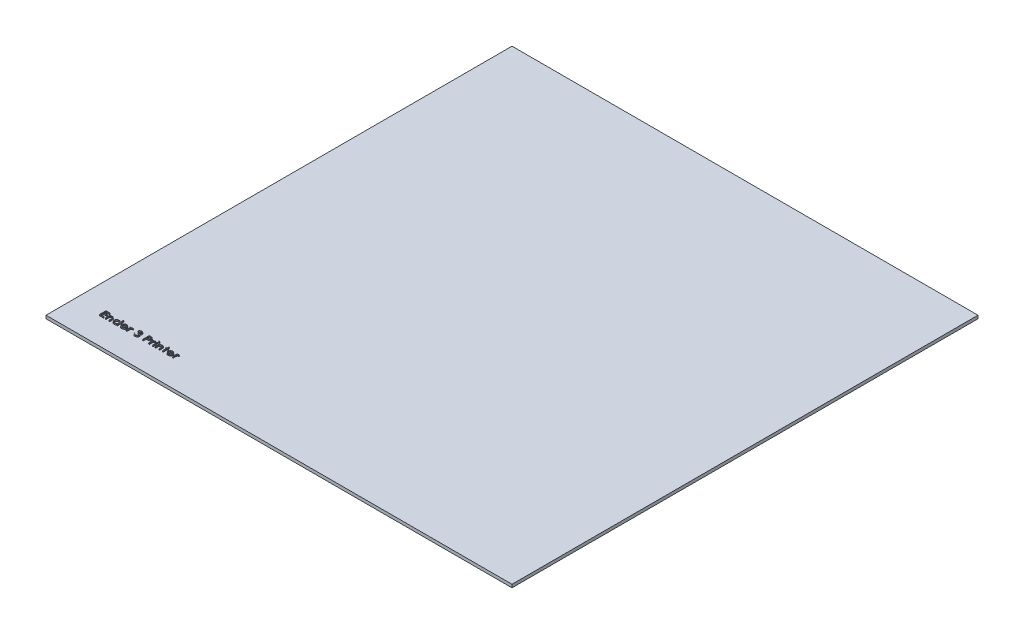
from build123d import *

# Parameters (mm, degrees)
CLAMP_DEPTH            = 10
CLAMP_DEPTH_BACK       = 10
SKETCH2_R              = 1
WHEEL_NUB_DEPTH        = 5.08
SKETCH3_W              = 225
SKETCH3_H              = 225
BED_DEPTH              = 1.5
INNER_FILLET_R         = 2.54
BOTTOM_CHAMFER_SIZE    = 0.254
PEG_CHAMFER_SIZE       = 0.254
BOSS_EXTRUDE4_DEPTH    = 0.5
BOSS_EXTRUDE4_2_DEPTH  = 0.5
BOSS_EXTRUDE4_3_DEPTH  = 0.5
BOSS_EXTRUDE4_4_DEPTH  = 0.5
BOSS_EXTRUDE4_5_DEPTH  = 0.5
BOSS_EXTRUDE4_6_DEPTH  = 0.5
BOSS_EXTRUDE4_7_DEPTH  = 0.5
BOSS_EXTRUDE4_8_DEPTH  = 0.5
BOSS_EXTRUDE4_9_DEPTH  = 0.5
SKETCH6_W              = 0.325641026
SKETCH6_H              = 2.320192308
BOSS_EXTRUDE4_10_DEPTH = 0.5
BOSS_EXTRUDE4_11_DEPTH = 0.5
BOSS_EXTRUDE4_12_DEPTH = 0.5
BOSS_EXTRUDE4_13_DEPTH = 0.5
BOSS_EXTRUDE4_14_DEPTH = 0.5


with BuildPart() as part:
    # Sketch1 → Clamp (new, two sides: drawn at the far end of the back side and taken through both)
    with BuildSketch(Plane.XY.offset(-CLAMP_DEPTH_BACK)):
        Polygon((-9.75, -8.5), (-9.75, 8.5), (9.75, 8.5), (9.75, -8.5), (11.25, -8.5), (11.25, 8.5), (11.25, 10), (-11.25, 10), (-11.25, 8.5), (-11.25, -8.5), align=None)
    extrude(amount=CLAMP_DEPTH + CLAMP_DEPTH_BACK)

    # Sketch2 → Wheel Nub (add)
    with BuildSketch(Plane(origin=(-9.75, 0, 0), x_dir=(0, 0, -1), z_dir=(1, 0, 0))):
        with Locations((-6, -5.5)):
            Circle(SKETCH2_R)
        with Locations((6, -5.5)):
            Circle(SKETCH2_R)
    wheel_nub = extrude(amount=WHEEL_NUB_DEPTH)

    # Nub Mirror: Wheel Nub across plane
    add(wheel_nub.mirror(Plane(origin=(0, 0, 0), x_dir=(0, 0, 1), z_dir=(1, 0, 0))))

    # Inner Fillet
    inner_fillet_edges = [part.edges().sort_by_distance(p)[0] for p in [
        (9.75, 8.5, 0),
        (-9.75, 8.5, 0),
    ]]
    fillet(inner_fillet_edges, radius=INNER_FILLET_R)

    # Bottom Chamfer
    bottom_chamfer_edges = [part.edges().sort_by_distance(p)[0] for p in [
        (10.5, -8.5, -10),
        (9.75, -8.5, 0),
        (10.5, -8.5, 10),
        (11.25, -8.5, 0),
        (-10.5, -8.5, -10),
        (-11.25, -8.5, 0),
        (-10.5, -8.5, 10),
        (-9.75, -8.5, 0),
    ]]
    chamfer(bottom_chamfer_edges, length=BOTTOM_CHAMFER_SIZE)

    # Peg Chamfer
    peg_chamfer_edges = [part.edges().sort_by_distance(p)[0] for p in [
        (-9.75, -5.5, -5),
        (-9.75, -5.5, 7),
        (9.75, -5.5, -5),
        (9.75, -5.5, 7),
    ]]
    chamfer(peg_chamfer_edges, length=PEG_CHAMFER_SIZE)


with BuildPart() as body_2:
    # Sketch3 → Bed (new body)
    with BuildSketch(Plane(origin=(0, 10, 0), x_dir=(1, 0, 0), z_dir=(0, 1, 0))):
        Rectangle(SKETCH3_W, SKETCH3_H)
    extrude(amount=BED_DEPTH)


with BuildPart() as body_3:
    # Sketch6 → Boss-Extrude4 (new body)
    with BuildSketch(Plane(origin=(0, 11.5, 0), x_dir=(1, 0, 0), z_dir=(0, 1, 0))):
        Polygon((-99.392948718, -96.625), (-97.439102564, -96.625), (-97.439102564, -96.950641026), (-99.067307692, -96.950641026), (-99.067307692, -97.927564103), (-97.439102564, -97.927564103), (-97.439102564, -98.253205128), (-99.067307692, -98.253205128), (-99.067307692, -99.474358974), (-97.439102564, -99.474358974), (-97.439102564, -99.8), (-99.392948718, -99.8), align=None)
    extrude(amount=BOSS_EXTRUDE4_DEPTH)


with BuildPart() as body_4:
    # Sketch6 → Boss-Extrude4 2 (new body)
    with BuildSketch(Plane(origin=(0, 11.5, 0), x_dir=(1, 0, 0), z_dir=(0, 1, 0))):
        with BuildLine():
            Line((-96.580224359, -97.479807692), (-96.254583333, -97.479807692))
            Line((-96.254583333, -97.479807692), (-96.254583333, -97.898307292))
            add(Edge.make_bspline(
                [(-96.254583333, -97.898307292), (-96.222662208, -97.860335804), (-96.160612491, -97.786525119), (-96.057773282, -97.689468383), (-95.948848934, -97.610218487), (-95.835222785, -97.546073852), (-95.715953468, -97.498720726), (-95.592207951, -97.46382747), (-95.463219432, -97.44321299), (-95.3754675, -97.440483195), (-95.331085737, -97.439102564)],
                knots=[0, 0, 0, 0, 1.111920242, 2.161400535, 3.161851767, 4.126104967, 5.07964332, 6.032517633, 7.00491838, 8, 8, 8, 8], degree=3))
            add(Edge.make_bspline(
                [(-95.331085737, -97.439102564), (-95.286246428, -97.440687296), (-95.198435288, -97.443790757), (-95.070436397, -97.46829981), (-94.950619804, -97.509969111), (-94.839720928, -97.567269255), (-94.739858611, -97.638544491), (-94.652244001, -97.721572994), (-94.579587428, -97.817093742), (-94.531150512, -97.906007654), (-94.498509392, -97.984526859), (-94.479129186, -98.052170752), (-94.460683214, -98.126898678), (-94.447583938, -98.209735617), (-94.435630076, -98.300015352), (-94.428765312, -98.398352332), (-94.423133419, -98.504154837), (-94.422948119, -98.577352966), (-94.422852564, -98.615099159)],
                knots=[0, 0, 0, 0, 1.266569471, 2.480388575, 3.666522241, 4.840213016, 5.995671761, 7.122871635, 8.238500001, 9.37270005, 9.9746134, 10.638003633, 11.358784284, 12.148732632, 13.006310612, 13.931773607, 14.933474477, 16, 16, 16, 16], degree=3))
            Line((-94.422852564, -98.615099159), (-94.422852564, -99.8))
            Line((-94.422852564, -99.8), (-94.74849359, -99.8))
            Line((-94.74849359, -99.8), (-94.74849359, -98.70859375))
            add(Edge.make_bspline(
                [(-94.74849359, -98.70859375), (-94.74836273, -98.677003925), (-94.748112416, -98.616577316), (-94.749810492, -98.530084677), (-94.750837813, -98.451635429), (-94.752610331, -98.381448374), (-94.755460246, -98.319563828), (-94.757458694, -98.265862292), (-94.761437525, -98.220515445), (-94.764360586, -98.192991637), (-94.765666066, -98.180699119)],
                knots=[0, 0, 0, 0, 1.434747502, 2.74445729, 3.92900273, 4.998231774, 5.933055848, 6.742823335, 7.438527271, 8, 8, 8, 8], degree=3))
            add(Edge.make_bspline(
                [(-94.765666066, -98.180699119), (-94.768335619, -98.162203923), (-94.773532746, -98.126197202), (-94.786116273, -98.074303934), (-94.803798782, -98.026208899), (-94.824152681, -97.980978926), (-94.850187368, -97.939782888), (-94.880034341, -97.902231312), (-94.914191406, -97.868102218), (-94.965545851, -97.827234848), (-95.039178373, -97.784871323), (-95.13912072, -97.74931163), (-95.250847913, -97.727409509), (-95.329495127, -97.725194071), (-95.37051883, -97.724038462)],
                knots=[0, 0, 0, 0, 0.798662195, 1.554847466, 2.277311119, 2.986925869, 3.670959394, 4.354632554, 5.033966419, 5.730377338, 7.155873038, 8.641058592, 10.247919944, 12, 12, 12, 12], degree=3))
            add(Edge.make_bspline(
                [(-95.37051883, -97.724038462), (-95.394922541, -97.724466016), (-95.443027799, -97.725308823), (-95.514315541, -97.733869157), (-95.583528214, -97.748057897), (-95.651346125, -97.766544128), (-95.716229934, -97.793038396), (-95.780368469, -97.82208842), (-95.841334307, -97.859324217), (-95.900908903, -97.89985733), (-95.956069731, -97.94560141), (-96.007631987, -97.993277337), (-96.053406933, -98.044315969), (-96.094235022, -98.098055364), (-96.130701429, -98.1540115), (-96.162060103, -98.212917358), (-96.188216353, -98.274458196), (-96.201508249, -98.317107379), (-96.208154046, -98.33843149)],
                knots=[0, 0, 0, 0, 1.051784021, 2.073305246, 3.089701923, 4.096642772, 5.098092538, 6.108057302, 7.128555677, 8.173166186, 9.212444457, 10.214769816, 11.198544065, 12.163800168, 13.122150482, 14.074905054, 15.037474226, 16, 16, 16, 16], degree=3))
            add(Edge.make_bspline(
                [(-96.208154046, -98.33843149), (-96.211934304, -98.354082312), (-96.22015907, -98.388134047), (-96.229405853, -98.444014192), (-96.236608398, -98.508811838), (-96.243848078, -98.582130057), (-96.248797171, -98.66444361), (-96.251476948, -98.755437645), (-96.254510163, -98.855283254), (-96.254558261, -98.924836889), (-96.254583333, -98.961092748)],
                knots=[0, 0, 0, 0, 0.617412555, 1.343314088, 2.170381765, 3.117878472, 4.168869578, 5.332398411, 6.609473285, 8, 8, 8, 8], degree=3))
            Line((-96.254583333, -98.961092748), (-96.254583333, -99.8))
            Line((-96.254583333, -99.8), (-96.580224359, -99.8))
            Line((-96.580224359, -99.8), (-96.580224359, -97.479807692))
        make_face()
    extrude(amount=BOSS_EXTRUDE4_2_DEPTH)


with BuildPart() as body_5:
    # Sketch6 → Boss-Extrude4 3 (new body)
    with BuildSketch(Plane(origin=(0, 11.5, 0), x_dir=(1, 0, 0), z_dir=(0, 1, 0))):
        with BuildLine():
            Line((-90.836730769, -96.543589744), (-90.836730769, -99.8))
            Line((-90.836730769, -99.8), (-91.162371795, -99.8))
            Line((-91.162371795, -99.8), (-91.162371795, -99.398672877))
            add(Edge.make_bspline(
                [(-91.162371795, -99.398672877), (-91.196762462, -99.435134896), (-91.26437884, -99.506823815), (-91.377966349, -99.598214424), (-91.49682019, -99.675603632), (-91.622358875, -99.736845553), (-91.753904279, -99.78355459), (-91.891262884, -99.816166429), (-92.034317323, -99.837558907), (-92.131796342, -99.83964588), (-92.181272035, -99.840705128)],
                knots=[0, 0, 0, 0, 1.048368602, 2.061224559, 3.043775472, 4.012553229, 4.978499756, 5.96037864, 6.964785641, 8, 8, 8, 8], degree=3))
            add(Edge.make_bspline(
                [(-92.181272035, -99.840705128), (-92.225423443, -99.839601968), (-92.312345335, -99.83743015), (-92.440265887, -99.820336702), (-92.563176402, -99.793285621), (-92.681287507, -99.754918142), (-92.794203046, -99.704870869), (-92.902613785, -99.644543496), (-93.005730968, -99.572495785), (-93.102582841, -99.490720644), (-93.191019554, -99.400981848), (-93.269370646, -99.306033757), (-93.335392063, -99.205644263), (-93.388877333, -99.100091031), (-93.431322654, -98.990225474), (-93.461190118, -98.875459588), (-93.479522676, -98.756041809), (-93.481541298, -98.67473868), (-93.482564103, -98.63354367)],
                knots=[0, 0, 0, 0, 1.073006613, 2.112452808, 3.131537238, 4.128992884, 5.125875819, 6.129556788, 7.140358021, 8.179037306, 9.206764687, 10.199268163, 11.167014935, 12.12125937, 13.070745913, 14.024558793, 14.999075164, 16, 16, 16, 16], degree=3))
            add(Edge.make_bspline(
                [(-93.482564103, -98.63354367), (-93.481601632, -98.593186276), (-93.479696637, -98.513307804), (-93.460379588, -98.396109172), (-93.430558992, -98.283042321), (-93.388488157, -98.174577295), (-93.333900327, -98.070789729), (-93.267030569, -97.971727111), (-93.188693112, -97.876680758), (-93.098690927, -97.788045338), (-93.001073628, -97.706385949), (-92.897036217, -97.635061766), (-92.788544676, -97.573901408), (-92.674441577, -97.525103055), (-92.556051116, -97.485908891), (-92.432469239, -97.45859342), (-92.304022074, -97.442598332), (-92.216722182, -97.44028029), (-92.172367788, -97.439102564)],
                knots=[0, 0, 0, 0, 0.982608992, 1.944855656, 2.885902759, 3.827956019, 4.773021323, 5.737262684, 6.73535209, 7.769099895, 8.810832312, 9.832479667, 10.838491863, 11.840357401, 12.851555398, 13.873006831, 14.919340111, 16, 16, 16, 16], degree=3))
            add(Edge.make_bspline(
                [(-92.172367788, -97.439102564), (-92.121399884, -97.440514754), (-92.02147378, -97.443283449), (-91.875212375, -97.466674013), (-91.73677011, -97.505490593), (-91.605610582, -97.559349818), (-91.482159416, -97.628496121), (-91.366242576, -97.71301684), (-91.258684262, -97.813681125), (-91.194880089, -97.889967929), (-91.162371795, -97.928836138)],
                knots=[0, 0, 0, 0, 1.049845003, 2.058293821, 3.043089991, 4.006944202, 4.973181735, 5.951902308, 6.956492028, 8, 8, 8, 8], degree=3))
            Line((-91.162371795, -97.928836138), (-91.162371795, -96.543589744))
            Line((-91.162371795, -96.543589744), (-90.836730769, -96.543589744))
        make_face()
        with BuildLine():
            add(Edge.make_bspline(
                [(-92.158375401, -97.724038462), (-92.202562861, -97.72553596), (-92.290021279, -97.728499896), (-92.418502555, -97.751198313), (-92.541652476, -97.789068667), (-92.65843569, -97.841214488), (-92.767465661, -97.906092726), (-92.864673914, -97.985314563), (-92.951129713, -98.07577656), (-93.023866827, -98.177570352), (-93.08353557, -98.286466841), (-93.125370624, -98.400563704), (-93.152421207, -98.517586168), (-93.155419492, -98.59693286), (-93.156923077, -98.636723758)],
                knots=[0, 0, 0, 0, 1.058508213, 2.095061622, 3.115540932, 4.138987951, 5.153187719, 6.14659773, 7.134849707, 8.14301248, 9.136422491, 10.100921388, 11.047647199, 12, 12, 12, 12], degree=3))
            add(Edge.make_bspline(
                [(-93.156923077, -98.636723758), (-93.155472394, -98.676315686), (-93.152570195, -98.755522313), (-93.124540227, -98.872162616), (-93.082748695, -98.986773288), (-93.022777371, -99.096439635), (-92.948983955, -99.198934689), (-92.862399183, -99.290733808), (-92.764193108, -99.370273195), (-92.655340575, -99.436624727), (-92.538938063, -99.490289207), (-92.416453932, -99.527430142), (-92.290131344, -99.551577365), (-92.204279392, -99.554362557), (-92.160919471, -99.555769231)],
                knots=[0, 0, 0, 0, 0.947466147, 1.895477207, 2.860160985, 3.865118257, 4.88056828, 5.879882647, 6.880630075, 7.900305211, 8.928127284, 9.943945958, 10.961580512, 12, 12, 12, 12], degree=3))
            add(Edge.make_bspline(
                [(-92.160919471, -99.555769231), (-92.117154232, -99.554263628), (-92.030116809, -99.551269383), (-91.901503647, -99.528349964), (-91.776408742, -99.490556005), (-91.656613883, -99.437916269), (-91.544589654, -99.373479742), (-91.44487941, -99.296647678), (-91.35950049, -99.20876642), (-91.288408021, -99.11085761), (-91.232353779, -99.004092806), (-91.191129211, -98.890416662), (-91.167229078, -98.769582379), (-91.164012389, -98.68707359), (-91.162371795, -98.644991987)],
                knots=[0, 0, 0, 0, 1.045163052, 2.078551398, 3.110449136, 4.160619821, 5.197873724, 6.190734051, 7.157847984, 8.115257474, 9.07136649, 10.029445637, 10.99496665, 12, 12, 12, 12], degree=3))
            add(Edge.make_bspline(
                [(-91.162371795, -98.644991987), (-91.163215878, -98.612935954), (-91.164878082, -98.549809849), (-91.178378393, -98.456978371), (-91.201533344, -98.368470084), (-91.232594756, -98.283531059), (-91.27381947, -98.203132305), (-91.323496822, -98.126455322), (-91.382668169, -98.054269443), (-91.449558883, -97.986784279), (-91.523130538, -97.925401697), (-91.601210237, -97.871084543), (-91.683963724, -97.82555983), (-91.771035179, -97.788761799), (-91.86198777, -97.759075066), (-91.957374285, -97.739348102), (-92.056431966, -97.725740704), (-92.12398224, -97.724612755), (-92.158375401, -97.724038462)],
                knots=[0, 0, 0, 0, 1.016356408, 2.00145226, 2.966870863, 3.913564647, 4.863761759, 5.826061372, 6.805796337, 7.818476539, 8.835166489, 9.840431463, 10.830471135, 11.824566403, 12.834564595, 13.859226969, 14.910027331, 16, 16, 16, 16], degree=3))
        make_face(mode=Mode.SUBTRACT)
    extrude(amount=BOSS_EXTRUDE4_3_DEPTH)


with BuildPart() as body_6:
    # Sketch6 → Boss-Extrude4 4 (new body)
    with BuildSketch(Plane(origin=(0, 11.5, 0), x_dir=(1, 0, 0), z_dir=(0, 1, 0))):
        with BuildLine():
            Line((-87.728258213, -99.067307692), (-87.454134615, -99.200235377))
            add(Edge.make_bspline(
                [(-87.454134615, -99.200235377), (-87.476349864, -99.236111543), (-87.519814663, -99.306304336), (-87.595169524, -99.401481355), (-87.673563664, -99.487812381), (-87.759150458, -99.561808132), (-87.849413389, -99.626413682), (-87.94483863, -99.682658627), (-88.045593237, -99.731185355), (-88.152157536, -99.771385549), (-88.264959505, -99.802705469), (-88.384557153, -99.824749529), (-88.5113065, -99.838304844), (-88.598295538, -99.839892121), (-88.642851562, -99.840705128)],
                knots=[0, 0, 0, 0, 1.069421058, 2.092354337, 3.074079004, 4.023050537, 4.955686955, 5.886197235, 6.82897851, 7.788750941, 8.771138075, 9.794142019, 10.87015348, 12, 12, 12, 12], degree=3))
            add(Edge.make_bspline(
                [(-88.642851562, -99.840705128), (-88.692303636, -99.839680165), (-88.788553432, -99.837685254), (-88.92881782, -99.820038814), (-89.060778744, -99.79192185), (-89.184573861, -99.751505603), (-89.30022109, -99.700222052), (-89.407299329, -99.636450626), (-89.506506216, -99.562060597), (-89.595396364, -99.476005542), (-89.674834493, -99.383439916), (-89.7454767, -99.287603717), (-89.80411157, -99.187588104), (-89.852762228, -99.085116571), (-89.890594492, -98.979663653), (-89.917193078, -98.871174061), (-89.93460104, -98.759827317), (-89.936295057, -98.684278123), (-89.937147436, -98.646264022)],
                knots=[0, 0, 0, 0, 1.205491613, 2.346278221, 3.441449179, 4.491059239, 5.516244435, 6.519929809, 7.523934692, 8.53314391, 9.53017636, 10.496012523, 11.432326375, 12.352762397, 13.258695543, 14.158990737, 15.073659048, 16, 16, 16, 16], degree=3))
            add(Edge.make_bspline(
                [(-89.937147436, -98.646264022), (-89.936365896, -98.610597637), (-89.934815256, -98.539832645), (-89.920156435, -98.435356017), (-89.897495943, -98.333484742), (-89.864730508, -98.234811757), (-89.823450014, -98.138782122), (-89.771819212, -98.046418326), (-89.712399324, -97.956026226), (-89.665708586, -97.900000795), (-89.642035256, -97.871594551)],
                knots=[0, 0, 0, 0, 1.009393624, 2.002718548, 2.981368972, 3.96092115, 4.942292709, 5.936433579, 6.953722102, 8, 8, 8, 8], degree=3))
            add(Edge.make_bspline(
                [(-89.642035256, -97.871594551), (-89.610294959, -97.837187453), (-89.547521053, -97.769139321), (-89.442032142, -97.680143095), (-89.327524637, -97.606080368), (-89.205759448, -97.544426292), (-89.075481166, -97.497690134), (-88.938033226, -97.462730361), (-88.792233476, -97.443327131), (-88.6925151, -97.440530875), (-88.641579527, -97.439102564)],
                knots=[0, 0, 0, 0, 0.996914619, 1.971633233, 2.931517459, 3.89730572, 4.873478647, 5.874999675, 6.914562053, 8, 8, 8, 8], degree=3))
            add(Edge.make_bspline(
                [(-88.641579527, -97.439102564), (-88.589134348, -97.440329938), (-88.486322321, -97.442736045), (-88.336298304, -97.465031091), (-88.194240577, -97.500413565), (-88.060273095, -97.550151624), (-87.934620151, -97.614747633), (-87.817769732, -97.694612702), (-87.707845058, -97.787395442), (-87.643284576, -97.859336505), (-87.610594952, -97.895763221)],
                knots=[0, 0, 0, 0, 1.078642804, 2.114540435, 3.113387415, 4.086610623, 5.048542974, 6.012925659, 6.993862624, 8, 8, 8, 8], degree=3))
            add(Edge.make_bspline(
                [(-87.610594952, -97.895763221), (-87.5886574, -97.923150627), (-87.545013617, -97.977636649), (-87.488842721, -98.066316287), (-87.441081338, -98.159762962), (-87.402185225, -98.258454134), (-87.371582613, -98.361899508), (-87.349549848, -98.470427153), (-87.335035577, -98.583972383), (-87.333037104, -98.661483259), (-87.332019231, -98.700961538)],
                knots=[0, 0, 0, 0, 0.967473567, 1.924745518, 2.889953502, 3.858752097, 4.846970718, 5.862117206, 6.911121386, 8, 8, 8, 8], degree=3))
            Line((-87.332019231, -98.700961538), (-89.61150641, -98.700961538))
            add(Edge.make_bspline(
                [(-89.61150641, -98.700961538), (-89.609923726, -98.73153573), (-89.60680884, -98.791708898), (-89.592973707, -98.879879015), (-89.569758238, -98.963489283), (-89.539217757, -99.042821726), (-89.500725534, -99.117923581), (-89.454162208, -99.188832), (-89.398849499, -99.255295049), (-89.336431196, -99.317057904), (-89.267756472, -99.372954564), (-89.194681839, -99.421851958), (-89.117766213, -99.463767271), (-89.036701059, -99.497389681), (-88.951733126, -99.523631837), (-88.862673203, -99.541796164), (-88.769951492, -99.553684447), (-88.706702546, -99.555068095), (-88.674652444, -99.555769231)],
                knots=[0, 0, 0, 0, 1.039073669, 2.045004336, 3.02296125, 3.980111893, 4.926619486, 5.882957722, 6.854402205, 7.857159866, 8.859995037, 9.85624635, 10.83864398, 11.829261994, 12.831114931, 13.853244543, 14.912175862, 16, 16, 16, 16], degree=3))
            add(Edge.make_bspline(
                [(-88.674652444, -99.555769231), (-88.64324956, -99.555196371), (-88.58048965, -99.554051489), (-88.487126892, -99.543612519), (-88.395158543, -99.526270901), (-88.305481929, -99.502894045), (-88.219628317, -99.474225906), (-88.140097555, -99.439679709), (-88.066969794, -99.401517493), (-87.998656869, -99.357788954), (-87.932178488, -99.304487636), (-87.866304442, -99.237574556), (-87.796181853, -99.158454803), (-87.751757724, -99.098841817), (-87.728258213, -99.067307692)],
                knots=[0, 0, 0, 0, 1.015876496, 2.030269486, 3.035340955, 4.042003172, 5.026901874, 5.961011991, 6.844769692, 7.693457895, 8.581624453, 9.595460568, 10.728044838, 12, 12, 12, 12], degree=3))
        make_face()
        with BuildLine():
            add(Edge.make_bspline(
                [(-87.657660256, -98.416025641), (-87.669169156, -98.3782202), (-87.691355979, -98.305338977), (-87.736239852, -98.204232733), (-87.78825474, -98.114854599), (-87.849252175, -98.036947753), (-87.919145607, -97.968856796), (-87.998237088, -97.907548671), (-88.088358025, -97.85463662), (-88.187060922, -97.808785131), (-88.291504289, -97.770385604), (-88.400595627, -97.744126066), (-88.512108044, -97.726559025), (-88.587662392, -97.724882193), (-88.625679087, -97.724038462)],
                knots=[0, 0, 0, 0, 1.104466817, 2.129188043, 3.086148352, 3.990031788, 4.887356204, 5.808921847, 6.782131386, 7.80343277, 8.850085455, 9.888441145, 10.937526563, 12, 12, 12, 12], degree=3))
            add(Edge.make_bspline(
                [(-88.625679087, -97.724038462), (-88.656658314, -97.724598303), (-88.71794092, -97.725705772), (-88.808168753, -97.73603402), (-88.89487331, -97.753328319), (-88.978522853, -97.776676353), (-89.058182859, -97.808231355), (-89.1354348, -97.844979547), (-89.208681265, -97.889704697), (-89.254546921, -97.924213669), (-89.277597155, -97.94155649)],
                knots=[0, 0, 0, 0, 1.060590219, 2.098042437, 3.104680641, 4.085971205, 5.067476599, 6.035109478, 7.012525024, 8, 8, 8, 8], degree=3))
            add(Edge.make_bspline(
                [(-89.277597155, -97.94155649), (-89.294005776, -97.955230926), (-89.327131861, -97.982837179), (-89.371899232, -98.030622507), (-89.415008227, -98.081861826), (-89.453783538, -98.139298704), (-89.489929581, -98.201341724), (-89.522706811, -98.268512454), (-89.554018169, -98.33985145), (-89.57058145, -98.390215799), (-89.579069511, -98.416025641)],
                knots=[0, 0, 0, 0, 0.898025486, 1.812953675, 2.750779549, 3.713399523, 4.724846977, 5.770194089, 6.857307995, 8, 8, 8, 8], degree=3))
            Line((-89.579069511, -98.416025641), (-87.657660256, -98.416025641))
        make_face(mode=Mode.SUBTRACT)
    extrude(amount=BOSS_EXTRUDE4_4_DEPTH)


with BuildPart() as body_7:
    # Sketch6 → Boss-Extrude4 5 (new body)
    with BuildSketch(Plane(origin=(0, 11.5, 0), x_dir=(1, 0, 0), z_dir=(0, 1, 0))):
        with BuildLine():
            Line((-86.554551282, -97.479807692), (-86.228910256, -97.479807692))
            Line((-86.228910256, -97.479807692), (-86.228910256, -97.821349159))
            add(Edge.make_bspline(
                [(-86.228910256, -97.821349159), (-86.205739034, -97.789525823), (-86.161270692, -97.72845304), (-86.088018338, -97.647507705), (-86.011837444, -97.581615651), (-85.934358228, -97.528367059), (-85.854423903, -97.488790315), (-85.773481302, -97.459582619), (-85.690274105, -97.442570236), (-85.634307727, -97.440260533), (-85.606248998, -97.439102564)],
                knots=[0, 0, 0, 0, 1.240427292, 2.380528127, 3.432374491, 4.409253451, 5.335797345, 6.23628025, 7.115759577, 8, 8, 8, 8], degree=3))
            add(Edge.make_bspline(
                [(-85.606248998, -97.439102564), (-85.584549994, -97.44018902), (-85.539846961, -97.442427275), (-85.47205928, -97.457919445), (-85.402153366, -97.482765665), (-85.356881255, -97.506363801), (-85.333397436, -97.518604768)],
                knots=[0, 0, 0, 0, 0.906785846, 1.868107758, 2.894132143, 4, 4, 4, 4], degree=3))
            Line((-85.333397436, -97.518604768), (-85.503214143, -97.765379607))
            add(Edge.make_bspline(
                [(-85.503214143, -97.765379607), (-85.518412986, -97.759271341), (-85.547238225, -97.74768676), (-85.58930263, -97.733831646), (-85.627993842, -97.725852246), (-85.652649088, -97.724614607), (-85.664126603, -97.724038462)],
                knots=[0, 0, 0, 0, 1.175706723, 2.229776724, 3.175925307, 4, 4, 4, 4], degree=3))
            add(Edge.make_bspline(
                [(-85.664126603, -97.724038462), (-85.689309636, -97.725551083), (-85.740483505, -97.728624846), (-85.815847635, -97.752948727), (-85.889337443, -97.792062812), (-85.947440283, -97.836272181), (-85.992753597, -97.878242384), (-86.024177229, -97.915848753), (-86.055287722, -97.956084106), (-86.082191908, -98.002131484), (-86.108465696, -98.05130834), (-86.131863225, -98.105243931), (-86.153502175, -98.162995918), (-86.165939487, -98.203314146), (-86.172304687, -98.223948317)],
                knots=[0, 0, 0, 0, 1.183530514, 2.405025401, 3.690504421, 5.087488046, 5.828652823, 6.592770524, 7.391046881, 8.219318711, 9.098612509, 10.014512879, 10.983862081, 12, 12, 12, 12], degree=3))
            add(Edge.make_bspline(
                [(-86.172304687, -98.223948317), (-86.177024013, -98.242335348), (-86.187464805, -98.28301386), (-86.198191466, -98.351354359), (-86.207405092, -98.432223376), (-86.215899264, -98.525505603), (-86.221030015, -98.631391078), (-86.225451687, -98.749695823), (-86.228948714, -98.88072274), (-86.228923464, -98.972326537), (-86.228910256, -99.020242388)],
                knots=[0, 0, 0, 0, 0.569195168, 1.259257812, 2.072569368, 3.011111867, 4.068392788, 5.252157063, 6.562666206, 8, 8, 8, 8], degree=3))
            Line((-86.228910256, -99.020242388), (-86.228910256, -99.8))
            Line((-86.228910256, -99.8), (-86.554551282, -99.8))
            Line((-86.554551282, -99.8), (-86.554551282, -97.479807692))
        make_face()
    extrude(amount=BOSS_EXTRUDE4_5_DEPTH)


with BuildPart() as body_8:
    # Sketch6 → Boss-Extrude4 6 (new body)
    with BuildSketch(Plane(origin=(0, 11.5, 0), x_dir=(1, 0, 0), z_dir=(0, 1, 0))):
        with BuildLine():
            Line((-82.882948718, -97.357692308), (-83.208589744, -97.357692308))
            add(Edge.make_bspline(
                [(-83.208589744, -97.357692308), (-83.200009202, -97.325722788), (-83.183216346, -97.263155699), (-83.14937203, -97.173739775), (-83.111615769, -97.0894341), (-83.0675326, -97.01091525), (-83.017877952, -96.93798762), (-82.962041086, -96.871175986), (-82.901882359, -96.808922682), (-82.835244147, -96.753881823), (-82.765047479, -96.704202653), (-82.690805126, -96.661513338), (-82.613589108, -96.625150167), (-82.533273651, -96.59501431), (-82.449528161, -96.572240737), (-82.362975508, -96.555876704), (-82.27327679, -96.545141475), (-82.212405595, -96.544113167), (-82.181421274, -96.543589744)],
                knots=[0, 0, 0, 0, 1.116355944, 2.184804219, 3.222141051, 4.231113984, 5.219328683, 6.194876446, 7.166217883, 8.136267484, 9.106844572, 10.065215996, 11.022117626, 11.98422021, 12.956167426, 13.946761748, 14.954871942, 16, 16, 16, 16], degree=3))
            add(Edge.make_bspline(
                [(-82.181421274, -96.543589744), (-82.136385326, -96.544846043), (-82.047264874, -96.547332099), (-81.916280468, -96.569829464), (-81.789985971, -96.605502054), (-81.669879068, -96.654879302), (-81.558398156, -96.715883054), (-81.458702309, -96.787852597), (-81.373382273, -96.870993702), (-81.301378825, -96.962147919), (-81.24507488, -97.059941737), (-81.203582794, -97.160511571), (-81.178234658, -97.263802143), (-81.174967319, -97.333599271), (-81.173333333, -97.368504607)],
                knots=[0, 0, 0, 0, 1.123321227, 2.222910833, 3.306649022, 4.393470362, 5.456864647, 6.471880394, 7.452320752, 8.420908763, 9.362108778, 10.259259549, 11.129460877, 12, 12, 12, 12], degree=3))
            add(Edge.make_bspline(
                [(-81.173333333, -97.368504607), (-81.174434868, -97.402107362), (-81.176595317, -97.468012735), (-81.197228839, -97.56393203), (-81.229814057, -97.654504003), (-81.275294272, -97.740048461), (-81.334887879, -97.819365043), (-81.406715079, -97.893672729), (-81.49205922, -97.962036479), (-81.555760828, -98.001379918), (-81.588652845, -98.021694712)],
                knots=[0, 0, 0, 0, 0.989635591, 1.940980818, 2.878257013, 3.820688598, 4.785857322, 5.793802215, 6.860840457, 8, 8, 8, 8], degree=3))
            add(Edge.make_bspline(
                [(-81.588652845, -98.021694712), (-81.551890409, -98.037901926), (-81.479662716, -98.069744478), (-81.381146329, -98.133642237), (-81.291302474, -98.206214533), (-81.241034422, -98.263865586), (-81.215946514, -98.292638221)],
                knots=[0, 0, 0, 0, 1.034096765, 2.031705015, 3.017658317, 4, 4, 4, 4], degree=3))
            add(Edge.make_bspline(
                [(-81.215946514, -98.292638221), (-81.199375788, -98.313516522), (-81.166624953, -98.354780965), (-81.126021956, -98.421573751), (-81.089370549, -98.488956596), (-81.061427415, -98.559279951), (-81.037791664, -98.630639574), (-81.022172404, -98.704446006), (-81.012319534, -98.779981934), (-81.01111699, -98.831102432), (-81.010512821, -98.856785857)],
                knots=[0, 0, 0, 0, 1.043047349, 2.06150724, 3.057059767, 4.044020338, 5.020973223, 5.99827899, 6.994316291, 8, 8, 8, 8], degree=3))
            add(Edge.make_bspline(
                [(-81.010512821, -98.856785857), (-81.011054899, -98.879063178), (-81.012136497, -98.923512651), (-81.019237896, -98.989868538), (-81.031245483, -99.055381493), (-81.048677579, -99.120182592), (-81.070964069, -99.184073062), (-81.097528211, -99.247397719), (-81.130013643, -99.309216809), (-81.165542575, -99.370647941), (-81.206375524, -99.429421897), (-81.250320205, -99.485672679), (-81.297695078, -99.538656709), (-81.350020771, -99.586788749), (-81.404357399, -99.633080708), (-81.463271378, -99.674722324), (-81.52495365, -99.713945058), (-81.590431965, -99.748561803), (-81.658579701, -99.779827756), (-81.728876223, -99.807024099), (-81.801233725, -99.830247824), (-81.875510079, -99.848312826), (-81.951684936, -99.863136489), (-82.029796716, -99.873933972), (-82.110073933, -99.88047239), (-82.16423651, -99.881095489), (-82.191597556, -99.881410256)],
                knots=[0, 0, 0, 0, 0.92169803, 1.839044851, 2.757774576, 3.674827786, 4.612457936, 5.555774093, 6.513016878, 7.499902905, 8.490174619, 9.47107816, 10.452334622, 11.426626846, 12.410467524, 13.403648671, 14.408766131, 15.432992845, 16.465300959, 17.509466555, 18.549756312, 19.60710264, 20.67025462, 21.759431652, 22.868142969, 24, 24, 24, 24], degree=3))
            add(Edge.make_bspline(
                [(-82.191597556, -99.881410256), (-82.228297737, -99.880635356), (-82.300165129, -99.879117923), (-82.405736039, -99.868448216), (-82.506264508, -99.849230747), (-82.602342323, -99.822958879), (-82.694107632, -99.790248112), (-82.781109922, -99.749167666), (-82.863430056, -99.700829997), (-82.940484297, -99.644734039), (-83.011978111, -99.581438919), (-83.077794436, -99.511516894), (-83.136497267, -99.433919605), (-83.188526531, -99.349662043), (-83.234968283, -99.258866881), (-83.272907625, -99.160481261), (-83.306981983, -99.055852635), (-83.322668956, -98.982678291), (-83.330705128, -98.945192308)],
                knots=[0, 0, 0, 0, 1.089030947, 2.132572979, 3.144340947, 4.122636792, 5.085826611, 6.031433048, 6.973369982, 7.914634373, 8.855057411, 9.803109251, 10.759391439, 11.737019511, 12.738643989, 13.780724783, 14.863102731, 16, 16, 16, 16], degree=3))
            Line((-83.330705128, -98.945192308), (-83.005064103, -98.945192308))
            add(Edge.make_bspline(
                [(-83.005064103, -98.945192308), (-82.997224025, -98.969645703), (-82.981966535, -99.017234191), (-82.956049351, -99.085654346), (-82.926913532, -99.148569524), (-82.894889668, -99.205953584), (-82.861274986, -99.258507762), (-82.824906017, -99.305939828), (-82.785771824, -99.348031544), (-82.757052004, -99.372227046), (-82.74302484, -99.384044471)],
                knots=[0, 0, 0, 0, 1.187591516, 2.311159086, 3.381569441, 4.391100686, 5.348474685, 6.26437783, 7.152297666, 8, 8, 8, 8], degree=3))
            add(Edge.make_bspline(
                [(-82.74302484, -99.384044471), (-82.724389678, -99.397749045), (-82.687142093, -99.42514147), (-82.626629713, -99.460228477), (-82.562719482, -99.490294916), (-82.494255578, -99.513542548), (-82.422754242, -99.532889073), (-82.347155718, -99.545876249), (-82.26812447, -99.554579229), (-82.214094929, -99.555367016), (-82.186509415, -99.555769231)],
                knots=[0, 0, 0, 0, 0.934841818, 1.868542889, 2.823608252, 3.786147903, 4.788489089, 5.816032122, 6.884945635, 8, 8, 8, 8], degree=3))
            add(Edge.make_bspline(
                [(-82.186509415, -99.555769231), (-82.155102557, -99.555213905), (-82.093833507, -99.554130567), (-82.004611324, -99.544105771), (-81.919944498, -99.529463595), (-81.840381258, -99.506658869), (-81.764757589, -99.479285096), (-81.694684539, -99.443624359), (-81.628651667, -99.403191403), (-81.56857684, -99.355933618), (-81.514325729, -99.305018633), (-81.466937251, -99.251270476), (-81.426371167, -99.195649964), (-81.393155489, -99.137709562), (-81.367249068, -99.07736504), (-81.349702768, -99.014663354), (-81.338418796, -98.950048755), (-81.336913086, -98.906229879), (-81.336153846, -98.884134615)],
                knots=[0, 0, 0, 0, 1.249364874, 2.437282909, 3.569203944, 4.664369636, 5.726875827, 6.764470109, 7.787556699, 8.80352195, 9.800248248, 10.744722387, 11.650966389, 12.535226244, 13.397106462, 14.257002303, 15.1211095, 16, 16, 16, 16], degree=3))
            add(Edge.make_bspline(
                [(-81.336153846, -98.884134615), (-81.337431206, -98.854527202), (-81.339983921, -98.795358859), (-81.362889082, -98.708638289), (-81.398752092, -98.624808934), (-81.449495547, -98.545761232), (-81.511284901, -98.472383464), (-81.58373591, -98.407495614), (-81.666354062, -98.353013806), (-81.742929601, -98.315915499), (-81.81086922, -98.290838983), (-81.868819805, -98.273622529), (-81.933558942, -98.259445316), (-82.004769646, -98.245914456), (-82.082678541, -98.23476962), (-82.167088989, -98.225208126), (-82.258080758, -98.217588557), (-82.321122257, -98.214236562), (-82.353782051, -98.2125)],
                knots=[0, 0, 0, 0, 1.042984283, 2.08433108, 3.143128335, 4.249222157, 5.385113909, 6.51878688, 7.668120448, 8.865777362, 9.511886398, 10.22190494, 10.99673624, 11.849106467, 12.778958184, 13.77268577, 14.846099398, 16, 16, 16, 16], degree=3))
            Line((-82.353782051, -98.2125), (-82.353782051, -97.886858974))
            add(Edge.make_bspline(
                [(-82.353782051, -97.886858974), (-82.3125963, -97.88619144), (-82.23185885, -97.884882855), (-82.113762726, -97.86907211), (-82.000794327, -97.847333547), (-81.895523494, -97.813876902), (-81.799799425, -97.775002204), (-81.716763324, -97.729837627), (-81.647535955, -97.679634565), (-81.592428209, -97.623583456), (-81.550863057, -97.563416616), (-81.520885025, -97.500562152), (-81.502069676, -97.434885878), (-81.500008101, -97.389826721), (-81.498974359, -97.367232572)],
                knots=[0, 0, 0, 0, 1.341656069, 2.630081648, 3.878419675, 5.087257311, 6.224426624, 7.242095775, 8.16131872, 9.001938776, 9.791789743, 10.533744472, 11.264771053, 12, 12, 12, 12], degree=3))
            add(Edge.make_bspline(
                [(-81.498974359, -97.367232572), (-81.499630902, -97.350658562), (-81.500936585, -97.317697439), (-81.509992503, -97.269370704), (-81.524969202, -97.222610969), (-81.545716122, -97.177476353), (-81.573831005, -97.134615905), (-81.606915914, -97.093173015), (-81.646044495, -97.053416274), (-81.691194311, -97.016521695), (-81.74004102, -96.981500767), (-81.793312479, -96.951652892), (-81.84948814, -96.926152303), (-81.908769512, -96.904976386), (-81.971450527, -96.889281767), (-82.037136913, -96.877887741), (-82.106003811, -96.870755874), (-82.152995147, -96.869745991), (-82.176969151, -96.869230769)],
                knots=[0, 0, 0, 0, 0.853648546, 1.697670886, 2.523188139, 3.378302657, 4.247803805, 5.156940784, 6.106885888, 7.11512794, 8.157515917, 9.199274311, 10.255022773, 11.332799812, 12.437414037, 13.579407759, 14.765064121, 16, 16, 16, 16], degree=3))
            add(Edge.make_bspline(
                [(-82.176969151, -96.869230769), (-82.215452319, -96.870461304), (-82.29027021, -96.872853674), (-82.398289036, -96.894705872), (-82.49876265, -96.928637815), (-82.575720821, -96.970031245), (-82.632547073, -97.010685524), (-82.673324299, -97.045888094), (-82.71263872, -97.085730876), (-82.749728378, -97.13103263), (-82.786080211, -97.180554346), (-82.820539284, -97.234923841), (-82.852983075, -97.294324599), (-82.872773061, -97.336174062), (-82.882948718, -97.357692308)],
                knots=[0, 0, 0, 0, 1.509259838, 2.934260404, 4.308252053, 5.660031487, 6.34601821, 7.048371135, 7.772289125, 8.540633061, 9.344706165, 10.182863007, 11.065660648, 12, 12, 12, 12], degree=3))
        make_face()
    extrude(amount=BOSS_EXTRUDE4_6_DEPTH)


with BuildPart() as body_9:
    # Sketch6 → Boss-Extrude4 7 (new body)
    with BuildSketch(Plane(origin=(0, 11.5, 0), x_dir=(1, 0, 0), z_dir=(0, 1, 0))):
        with BuildLine():
            Line((-78.560064103, -96.625), (-77.885249399, -96.625))
            add(Edge.make_bspline(
                [(-77.885249399, -96.625), (-77.838818357, -96.62504549), (-77.749976499, -96.625132532), (-77.62255521, -96.627881092), (-77.506992605, -96.631504395), (-77.403101774, -96.63663525), (-77.310999421, -96.64250943), (-77.230872797, -96.650981738), (-77.162361775, -96.659742293), (-77.121136699, -96.668638817), (-77.102311699, -96.672701322)],
                knots=[0, 0, 0, 0, 1.418409831, 2.714006813, 3.893404716, 4.950375869, 5.891726568, 6.712121466, 7.411903736, 8, 8, 8, 8], degree=3))
            add(Edge.make_bspline(
                [(-77.102311699, -96.672701322), (-77.078458066, -96.678687005), (-77.031507108, -96.690468588), (-76.963769621, -96.714391121), (-76.899301564, -96.742328462), (-76.83806987, -96.77489224), (-76.780060687, -96.811677935), (-76.725749157, -96.853366154), (-76.6747293, -96.899315878), (-76.62712432, -96.949352573), (-76.583879024, -97.003211953), (-76.545938991, -97.060810675), (-76.514466756, -97.121945127), (-76.487566649, -97.18615451), (-76.468697989, -97.254267127), (-76.453408682, -97.325313737), (-76.445531806, -97.399917932), (-76.444117507, -97.450748097), (-76.443397436, -97.476627604)],
                knots=[0, 0, 0, 0, 1.044614879, 2.05610904, 3.048648156, 4.028015397, 5.000229019, 5.96426823, 6.933932136, 7.915327783, 8.896020172, 9.865558509, 10.840731438, 11.814446678, 12.818086411, 13.839363335, 14.899940407, 16, 16, 16, 16], degree=3))
            add(Edge.make_bspline(
                [(-76.443397436, -97.476627604), (-76.443736126, -97.502736715), (-76.444399111, -97.553845272), (-76.454005367, -97.628620769), (-76.467505785, -97.700010712), (-76.487458467, -97.767894653), (-76.512761496, -97.832315917), (-76.544276866, -97.893135206), (-76.581097791, -97.950609896), (-76.623984665, -98.00387174), (-76.671181851, -98.053676802), (-76.722740821, -98.099620157), (-76.778972664, -98.141082564), (-76.839511982, -98.177920619), (-76.904262747, -98.210434201), (-76.973035404, -98.239162887), (-77.046468875, -98.263342357), (-77.097346074, -98.276003206), (-77.12330028, -98.282461939)],
                knots=[0, 0, 0, 0, 1.088161205, 2.130074408, 3.139321425, 4.115850349, 5.076395988, 6.021556806, 6.968288003, 7.918357923, 8.869044838, 9.827308699, 10.794667379, 11.778852344, 12.779307233, 13.813840501, 14.884765, 16, 16, 16, 16], degree=3))
            add(Edge.make_bspline(
                [(-77.12330028, -98.282461939), (-77.144678423, -98.286689475), (-77.191473713, -98.295943263), (-77.268550604, -98.306353514), (-77.358081254, -98.315091391), (-77.460334303, -98.321818383), (-77.575047891, -98.327421757), (-77.702469701, -98.331944644), (-77.842414158, -98.334419212), (-77.939945972, -98.334548129), (-77.990828325, -98.334615385)],
                knots=[0, 0, 0, 0, 0.60082097, 1.315155928, 2.143520297, 3.081116683, 4.140582134, 5.31053358, 6.59690521, 8, 8, 8, 8], degree=3))
            Line((-77.990828325, -98.334615385), (-78.234423077, -98.334615385))
            Line((-78.234423077, -98.334615385), (-78.234423077, -99.8))
            Line((-78.234423077, -99.8), (-78.560064103, -99.8))
            Line((-78.560064103, -99.8), (-78.560064103, -96.625))
        make_face()
        with BuildLine():
            Line((-78.234423077, -96.950641026), (-78.234423077, -98.008974359))
            Line((-78.234423077, -98.008974359), (-77.646106771, -98.015970553))
            add(Edge.make_bspline(
                [(-77.646106771, -98.015970553), (-77.617269317, -98.015985536), (-77.561694507, -98.016014412), (-77.481553819, -98.012405615), (-77.407306293, -98.008221168), (-77.33896495, -98.002066622), (-77.276658864, -97.993592729), (-77.220214323, -97.984626638), (-77.170048371, -97.972211983), (-77.111302971, -97.955187688), (-77.045897295, -97.926395108), (-76.974882702, -97.884176428), (-76.914049172, -97.831053031), (-76.862136574, -97.770547005), (-76.821184066, -97.703332267), (-76.79049154, -97.631759539), (-76.772146527, -97.555988004), (-76.770080262, -97.504074283), (-76.769038462, -97.477899639)],
                knots=[0, 0, 0, 0, 1.187936968, 2.289362064, 3.304418159, 4.251789532, 5.115278311, 5.895009063, 6.604718384, 7.243061292, 8.41291016, 9.537911015, 10.634059128, 11.724519996, 12.810599303, 13.863471255, 14.922772688, 16, 16, 16, 16], degree=3))
            add(Edge.make_bspline(
                [(-76.769038462, -97.477899639), (-76.770087497, -97.452357452), (-76.772176803, -97.401486512), (-76.79063314, -97.327035897), (-76.821128268, -97.256211864), (-76.862400591, -97.189862069), (-76.91283901, -97.129496466), (-76.972287294, -97.078078822), (-77.03890602, -97.035545044), (-77.101281964, -97.008871085), (-77.156666894, -96.992413082), (-77.20459337, -96.980854653), (-77.258777728, -96.97148526), (-77.319099413, -96.964202026), (-77.38545197, -96.957649142), (-77.458009824, -96.953398827), (-77.5369043, -96.950823431), (-77.591619038, -96.950703369), (-77.620030048, -96.950641026)],
                knots=[0, 0, 0, 0, 1.079672715, 2.15032351, 3.223565093, 4.331534505, 5.445842985, 6.539700356, 7.644832641, 8.778158669, 9.396906618, 10.088920543, 10.863330602, 11.722450615, 12.659849889, 13.684592725, 14.7977086, 16, 16, 16, 16], degree=3))
            Line((-77.620030048, -96.950641026), (-78.234423077, -96.950641026))
        make_face(mode=Mode.SUBTRACT)
    extrude(amount=BOSS_EXTRUDE4_7_DEPTH)


with BuildPart() as body_10:
    # Sketch6 → Boss-Extrude4 8 (new body)
    with BuildSketch(Plane(origin=(0, 11.5, 0), x_dir=(1, 0, 0), z_dir=(0, 1, 0))):
        with BuildLine():
            Line((-75.625224359, -97.479807692), (-75.299583333, -97.479807692))
            Line((-75.299583333, -97.479807692), (-75.299583333, -97.821349159))
            add(Edge.make_bspline(
                [(-75.299583333, -97.821349159), (-75.276412111, -97.789525823), (-75.231943769, -97.72845304), (-75.158691415, -97.647507705), (-75.082510521, -97.581615651), (-75.005031305, -97.528367059), (-74.92509698, -97.488790315), (-74.844154379, -97.459582619), (-74.760947182, -97.442570236), (-74.704980804, -97.440260533), (-74.676922075, -97.439102564)],
                knots=[0, 0, 0, 0, 1.240427292, 2.380528127, 3.432374491, 4.409253451, 5.335797345, 6.23628025, 7.115759577, 8, 8, 8, 8], degree=3))
            add(Edge.make_bspline(
                [(-74.676922075, -97.439102564), (-74.655223071, -97.44018902), (-74.610520038, -97.442427275), (-74.542732357, -97.457919445), (-74.472826443, -97.482765665), (-74.427554332, -97.506363801), (-74.404070513, -97.518604768)],
                knots=[0, 0, 0, 0, 0.906785846, 1.868107758, 2.894132143, 4, 4, 4, 4], degree=3))
            Line((-74.404070513, -97.518604768), (-74.57388722, -97.765379607))
            add(Edge.make_bspline(
                [(-74.57388722, -97.765379607), (-74.589086063, -97.759271341), (-74.617911302, -97.74768676), (-74.659975707, -97.733831646), (-74.698666919, -97.725852246), (-74.723322165, -97.724614607), (-74.734799679, -97.724038462)],
                knots=[0, 0, 0, 0, 1.175706723, 2.229776724, 3.175925307, 4, 4, 4, 4], degree=3))
            add(Edge.make_bspline(
                [(-74.734799679, -97.724038462), (-74.759982713, -97.725551083), (-74.811156582, -97.728624846), (-74.886520712, -97.752948727), (-74.96001052, -97.792062812), (-75.01811336, -97.836272181), (-75.063426674, -97.878242384), (-75.094850306, -97.915848753), (-75.125960799, -97.956084106), (-75.152864985, -98.002131484), (-75.179138773, -98.05130834), (-75.202536302, -98.105243931), (-75.224175252, -98.162995918), (-75.236612564, -98.203314146), (-75.242977764, -98.223948317)],
                knots=[0, 0, 0, 0, 1.183530514, 2.405025401, 3.690504421, 5.087488046, 5.828652823, 6.592770524, 7.391046881, 8.219318711, 9.098612509, 10.014512879, 10.983862081, 12, 12, 12, 12], degree=3))
            add(Edge.make_bspline(
                [(-75.242977764, -98.223948317), (-75.24769709, -98.242335348), (-75.258137882, -98.28301386), (-75.268864543, -98.351354359), (-75.278078169, -98.432223376), (-75.286572341, -98.525505603), (-75.291703092, -98.631391078), (-75.296124764, -98.749695823), (-75.299621791, -98.88072274), (-75.299596541, -98.972326537), (-75.299583333, -99.020242388)],
                knots=[0, 0, 0, 0, 0.569195168, 1.259257812, 2.072569368, 3.011111867, 4.068392788, 5.252157063, 6.562666206, 8, 8, 8, 8], degree=3))
            Line((-75.299583333, -99.020242388), (-75.299583333, -99.8))
            Line((-75.299583333, -99.8), (-75.625224359, -99.8))
            Line((-75.625224359, -99.8), (-75.625224359, -97.479807692))
        make_face()
    extrude(amount=BOSS_EXTRUDE4_8_DEPTH)


with BuildPart() as body_11:
    # Sketch6 → Boss-Extrude4 9 (new body)
    with BuildSketch(Plane(origin=(0, 11.5, 0), x_dir=(1, 0, 0), z_dir=(0, 1, 0))):
        with BuildLine():
            add(Edge.make_bspline(
                [(-73.668579728, -96.502884615), (-73.649422102, -96.503699733), (-73.612095037, -96.505287924), (-73.558219036, -96.518896316), (-73.509308789, -96.542321481), (-73.465751811, -96.573384724), (-73.428470633, -96.610162631), (-73.402184692, -96.653056199), (-73.384934282, -96.699413959), (-73.383233907, -96.731910996), (-73.382371795, -96.74838742)],
                knots=[0, 0, 0, 0, 1.097978545, 2.139321259, 3.162173311, 4.19151332, 5.197815518, 6.142860071, 7.058405672, 8, 8, 8, 8], degree=3))
            add(Edge.make_bspline(
                [(-73.382371795, -96.74838742), (-73.383257549, -96.764436615), (-73.385016197, -96.796301983), (-73.402177836, -96.841857761), (-73.428683655, -96.884139117), (-73.465727992, -96.920861976), (-73.509315181, -96.951905013), (-73.558217304, -96.975335611), (-73.6120955, -96.988942535), (-73.649422259, -96.990530931), (-73.668579728, -96.991346154)],
                knots=[0, 0, 0, 0, 0.922703544, 1.832010186, 2.772146749, 3.784264281, 4.819552758, 5.848315786, 6.89567633, 8, 8, 8, 8], degree=3))
            add(Edge.make_bspline(
                [(-73.668579728, -96.991346154), (-73.687320911, -96.990546012), (-73.723826705, -96.988987422), (-73.776750632, -96.975074762), (-73.825305608, -96.951927306), (-73.868885974, -96.920856121), (-73.905932077, -96.884140549), (-73.932437463, -96.841857404), (-73.94959921, -96.796302072), (-73.951357843, -96.764436644), (-73.95224359, -96.74838742)],
                knots=[0, 0, 0, 0, 1.086463775, 2.116313756, 3.151298715, 4.192848589, 5.211087382, 6.156909866, 7.071715969, 8, 8, 8, 8], degree=3))
            add(Edge.make_bspline(
                [(-73.95224359, -96.74838742), (-73.951381485, -96.731910964), (-73.949681125, -96.699413866), (-73.932430605, -96.653056561), (-73.906145103, -96.610161182), (-73.868862153, -96.573390578), (-73.825312005, -96.542299186), (-73.776748944, -96.519157137), (-73.723827153, -96.505243048), (-73.687321063, -96.503684656), (-73.668579728, -96.502884615)],
                knots=[0, 0, 0, 0, 0.947256149, 1.868306938, 2.819034057, 3.831387165, 4.86691661, 5.895919087, 6.919816268, 8, 8, 8, 8], degree=3))
        make_face()
    extrude(amount=BOSS_EXTRUDE4_9_DEPTH)


with BuildPart() as body_12:
    # Sketch6 → Boss-Extrude4 10 (new body)
    with BuildSketch(Plane(origin=(0, 11.5, 0), x_dir=(1, 0, 0), z_dir=(0, 1, 0))):
        with Locations((-73.667307692, -98.639903846)):
            Rectangle(SKETCH6_W, SKETCH6_H)
    extrude(amount=BOSS_EXTRUDE4_10_DEPTH)


with BuildPart() as body_13:
    # Sketch6 → Boss-Extrude4 11 (new body)
    with BuildSketch(Plane(origin=(0, 11.5, 0), x_dir=(1, 0, 0), z_dir=(0, 1, 0))):
        with BuildLine():
            Line((-72.564198718, -97.479807692), (-72.238557692, -97.479807692))
            Line((-72.238557692, -97.479807692), (-72.238557692, -97.898307292))
            add(Edge.make_bspline(
                [(-72.238557692, -97.898307292), (-72.206636567, -97.860335804), (-72.14458685, -97.786525119), (-72.041747641, -97.689468383), (-71.932823293, -97.610218487), (-71.819197144, -97.546073852), (-71.699927827, -97.498720726), (-71.57618231, -97.46382747), (-71.447193791, -97.44321299), (-71.359441859, -97.440483195), (-71.315060096, -97.439102564)],
                knots=[0, 0, 0, 0, 1.111920242, 2.161400535, 3.161851767, 4.126104967, 5.07964332, 6.032517633, 7.00491838, 8, 8, 8, 8], degree=3))
            add(Edge.make_bspline(
                [(-71.315060096, -97.439102564), (-71.270220787, -97.440687296), (-71.182409647, -97.443790757), (-71.054410756, -97.46829981), (-70.934594163, -97.509969111), (-70.823695287, -97.567269255), (-70.72383297, -97.638544491), (-70.63621836, -97.721572994), (-70.563561787, -97.817093742), (-70.515124871, -97.906007654), (-70.482483751, -97.984526859), (-70.463103545, -98.052170752), (-70.444657573, -98.126898678), (-70.431558297, -98.209735617), (-70.419604435, -98.300015352), (-70.412739671, -98.398352332), (-70.407107778, -98.504154837), (-70.406922477, -98.577352966), (-70.406826923, -98.615099159)],
                knots=[0, 0, 0, 0, 1.266569471, 2.480388575, 3.666522241, 4.840213016, 5.995671761, 7.122871635, 8.238500001, 9.37270005, 9.9746134, 10.638003633, 11.358784284, 12.148732632, 13.006310612, 13.931773607, 14.933474477, 16, 16, 16, 16], degree=3))
            Line((-70.406826923, -98.615099159), (-70.406826923, -99.8))
            Line((-70.406826923, -99.8), (-70.732467949, -99.8))
            Line((-70.732467949, -99.8), (-70.732467949, -98.70859375))
            add(Edge.make_bspline(
                [(-70.732467949, -98.70859375), (-70.732337089, -98.677003925), (-70.732086775, -98.616577316), (-70.733784851, -98.530084677), (-70.734812172, -98.451635429), (-70.73658469, -98.381448374), (-70.739434605, -98.319563828), (-70.741433053, -98.265862292), (-70.745411884, -98.220515445), (-70.748334945, -98.192991637), (-70.749640425, -98.180699119)],
                knots=[0, 0, 0, 0, 1.434747502, 2.74445729, 3.92900273, 4.998231774, 5.933055848, 6.742823335, 7.438527271, 8, 8, 8, 8], degree=3))
            add(Edge.make_bspline(
                [(-70.749640425, -98.180699119), (-70.752309978, -98.162203923), (-70.757507105, -98.126197202), (-70.770090632, -98.074303934), (-70.787773141, -98.026208899), (-70.80812704, -97.980978926), (-70.834161727, -97.939782888), (-70.8640087, -97.902231312), (-70.898165765, -97.868102218), (-70.94952021, -97.827234848), (-71.023152732, -97.784871323), (-71.123095079, -97.74931163), (-71.234822272, -97.727409509), (-71.313469486, -97.725194071), (-71.354493189, -97.724038462)],
                knots=[0, 0, 0, 0, 0.798662195, 1.554847466, 2.277311119, 2.986925869, 3.670959394, 4.354632554, 5.033966419, 5.730377338, 7.155873038, 8.641058592, 10.247919944, 12, 12, 12, 12], degree=3))
            add(Edge.make_bspline(
                [(-71.354493189, -97.724038462), (-71.3788969, -97.724466016), (-71.427002158, -97.725308823), (-71.4982899, -97.733869157), (-71.567502573, -97.748057897), (-71.635320484, -97.766544128), (-71.700204293, -97.793038396), (-71.764342828, -97.82208842), (-71.825308666, -97.859324217), (-71.884883262, -97.89985733), (-71.94004409, -97.94560141), (-71.991606346, -97.993277337), (-72.037381292, -98.044315969), (-72.078209381, -98.098055364), (-72.114675788, -98.1540115), (-72.146034462, -98.212917358), (-72.172190712, -98.274458196), (-72.185482608, -98.317107379), (-72.192128405, -98.33843149)],
                knots=[0, 0, 0, 0, 1.051784021, 2.073305246, 3.089701923, 4.096642772, 5.098092538, 6.108057302, 7.128555677, 8.173166186, 9.212444457, 10.214769816, 11.198544065, 12.163800168, 13.122150482, 14.074905054, 15.037474226, 16, 16, 16, 16], degree=3))
            add(Edge.make_bspline(
                [(-72.192128405, -98.33843149), (-72.195908663, -98.354082312), (-72.204133429, -98.388134047), (-72.213380212, -98.444014192), (-72.220582757, -98.508811838), (-72.227822437, -98.582130057), (-72.23277153, -98.66444361), (-72.235451307, -98.755437645), (-72.238484522, -98.855283254), (-72.23853262, -98.924836889), (-72.238557692, -98.961092748)],
                knots=[0, 0, 0, 0, 0.617412555, 1.343314088, 2.170381765, 3.117878472, 4.168869578, 5.332398411, 6.609473285, 8, 8, 8, 8], degree=3))
            Line((-72.238557692, -98.961092748), (-72.238557692, -99.8))
            Line((-72.238557692, -99.8), (-72.564198718, -99.8))
            Line((-72.564198718, -99.8), (-72.564198718, -97.479807692))
        make_face()
    extrude(amount=BOSS_EXTRUDE4_11_DEPTH)


with BuildPart() as body_14:
    # Sketch6 → Boss-Extrude4 12 (new body)
    with BuildSketch(Plane(origin=(0, 11.5, 0), x_dir=(1, 0, 0), z_dir=(0, 1, 0))):
        Polygon((-69.059487179, -96.543589744), (-68.733846154, -96.543589744), (-68.733846154, -97.479807692), (-68.286089744, -97.479807692), (-68.286089744, -97.76474359), (-68.733846154, -97.76474359), (-68.733846154, -99.8), (-69.059487179, -99.8), (-69.059487179, -97.76474359), (-69.50724359, -97.76474359), (-69.50724359, -97.479807692), (-69.059487179, -97.479807692), align=None)
    extrude(amount=BOSS_EXTRUDE4_12_DEPTH)


with BuildPart() as body_15:
    # Sketch6 → Boss-Extrude4 13 (new body)
    with BuildSketch(Plane(origin=(0, 11.5, 0), x_dir=(1, 0, 0), z_dir=(0, 1, 0))):
        with BuildLine():
            Line((-65.3404377, -99.067307692), (-65.066314103, -99.200235377))
            add(Edge.make_bspline(
                [(-65.066314103, -99.200235377), (-65.088529351, -99.236111543), (-65.131994151, -99.306304336), (-65.207349011, -99.401481355), (-65.285743151, -99.487812381), (-65.371329946, -99.561808132), (-65.461592877, -99.626413682), (-65.557018117, -99.682658627), (-65.657772724, -99.731185355), (-65.764337023, -99.771385549), (-65.877138992, -99.802705469), (-65.99673664, -99.824749529), (-66.123485987, -99.838304844), (-66.210475025, -99.839892121), (-66.25503105, -99.840705128)],
                knots=[0, 0, 0, 0, 1.069421058, 2.092354337, 3.074079004, 4.023050537, 4.955686955, 5.886197235, 6.82897851, 7.788750941, 8.771138075, 9.794142019, 10.87015348, 12, 12, 12, 12], degree=3))
            add(Edge.make_bspline(
                [(-66.25503105, -99.840705128), (-66.304483123, -99.839680165), (-66.400732919, -99.837685254), (-66.540997307, -99.820038814), (-66.672958231, -99.79192185), (-66.796753348, -99.751505603), (-66.912400577, -99.700222052), (-67.019478816, -99.636450626), (-67.118685704, -99.562060597), (-67.207575851, -99.476005542), (-67.28701398, -99.383439916), (-67.357656187, -99.287603717), (-67.416291058, -99.187588104), (-67.464941715, -99.085116571), (-67.502773979, -98.979663653), (-67.529372565, -98.871174061), (-67.546780527, -98.759827317), (-67.548474544, -98.684278123), (-67.549326923, -98.646264022)],
                knots=[0, 0, 0, 0, 1.205491613, 2.346278221, 3.441449179, 4.491059239, 5.516244435, 6.519929809, 7.523934692, 8.53314391, 9.53017636, 10.496012523, 11.432326375, 12.352762397, 13.258695543, 14.158990737, 15.073659048, 16, 16, 16, 16], degree=3))
            add(Edge.make_bspline(
                [(-67.549326923, -98.646264022), (-67.548545383, -98.610597637), (-67.546994744, -98.539832645), (-67.532335922, -98.435356017), (-67.509675431, -98.333484742), (-67.476909995, -98.234811757), (-67.435629501, -98.138782122), (-67.383998699, -98.046418326), (-67.324578811, -97.956026226), (-67.277888073, -97.900000795), (-67.254214744, -97.871594551)],
                knots=[0, 0, 0, 0, 1.009393624, 2.002718548, 2.981368972, 3.96092115, 4.942292709, 5.936433579, 6.953722102, 8, 8, 8, 8], degree=3))
            add(Edge.make_bspline(
                [(-67.254214744, -97.871594551), (-67.222474446, -97.837187453), (-67.15970054, -97.769139321), (-67.054211629, -97.680143095), (-66.939704124, -97.606080368), (-66.817938935, -97.544426292), (-66.687660653, -97.497690134), (-66.550212713, -97.462730361), (-66.404412964, -97.443327131), (-66.304694588, -97.440530875), (-66.253759014, -97.439102564)],
                knots=[0, 0, 0, 0, 0.996914619, 1.971633233, 2.931517459, 3.89730572, 4.873478647, 5.874999675, 6.914562053, 8, 8, 8, 8], degree=3))
            add(Edge.make_bspline(
                [(-66.253759014, -97.439102564), (-66.201313835, -97.440329938), (-66.098501809, -97.442736045), (-65.948477791, -97.465031091), (-65.806420064, -97.500413565), (-65.672452582, -97.550151624), (-65.546799638, -97.614747633), (-65.429949219, -97.694612702), (-65.320024545, -97.787395442), (-65.255464063, -97.859336505), (-65.222774439, -97.895763221)],
                knots=[0, 0, 0, 0, 1.078642804, 2.114540435, 3.113387415, 4.086610623, 5.048542974, 6.012925659, 6.993862624, 8, 8, 8, 8], degree=3))
            add(Edge.make_bspline(
                [(-65.222774439, -97.895763221), (-65.200836887, -97.923150627), (-65.157193105, -97.977636649), (-65.101022208, -98.066316287), (-65.053260825, -98.159762962), (-65.014364713, -98.258454134), (-64.9837621, -98.361899508), (-64.961729335, -98.470427153), (-64.947215064, -98.583972383), (-64.945216591, -98.661483259), (-64.944198718, -98.700961538)],
                knots=[0, 0, 0, 0, 0.967473567, 1.924745518, 2.889953502, 3.858752097, 4.846970718, 5.862117206, 6.911121386, 8, 8, 8, 8], degree=3))
            Line((-64.944198718, -98.700961538), (-67.223685897, -98.700961538))
            add(Edge.make_bspline(
                [(-67.223685897, -98.700961538), (-67.222103213, -98.73153573), (-67.218988327, -98.791708898), (-67.205153194, -98.879879015), (-67.181937725, -98.963489283), (-67.151397244, -99.042821726), (-67.112905021, -99.117923581), (-67.066341695, -99.188832), (-67.011028986, -99.255295049), (-66.948610683, -99.317057904), (-66.879935959, -99.372954564), (-66.806861326, -99.421851958), (-66.729945701, -99.463767271), (-66.648880546, -99.497389681), (-66.563912614, -99.523631837), (-66.474852691, -99.541796164), (-66.382130979, -99.553684447), (-66.318882033, -99.555068095), (-66.286831931, -99.555769231)],
                knots=[0, 0, 0, 0, 1.039073669, 2.045004336, 3.02296125, 3.980111893, 4.926619486, 5.882957722, 6.854402205, 7.857159866, 8.859995037, 9.85624635, 10.83864398, 11.829261994, 12.831114931, 13.853244543, 14.912175862, 16, 16, 16, 16], degree=3))
            add(Edge.make_bspline(
                [(-66.286831931, -99.555769231), (-66.255429047, -99.555196371), (-66.192669137, -99.554051489), (-66.09930638, -99.543612519), (-66.00733803, -99.526270901), (-65.917661416, -99.502894045), (-65.831807805, -99.474225906), (-65.752277042, -99.439679709), (-65.679149281, -99.401517493), (-65.610836356, -99.357788954), (-65.544357976, -99.304487636), (-65.47848393, -99.237574556), (-65.40836134, -99.158454803), (-65.363937211, -99.098841817), (-65.3404377, -99.067307692)],
                knots=[0, 0, 0, 0, 1.015876496, 2.030269486, 3.035340955, 4.042003172, 5.026901874, 5.961011991, 6.844769692, 7.693457895, 8.581624453, 9.595460568, 10.728044838, 12, 12, 12, 12], degree=3))
        make_face()
        with BuildLine():
            add(Edge.make_bspline(
                [(-65.269839744, -98.416025641), (-65.281348643, -98.3782202), (-65.303535466, -98.305338977), (-65.348419339, -98.204232733), (-65.400434227, -98.114854599), (-65.461431662, -98.036947753), (-65.531325094, -97.968856796), (-65.610416575, -97.907548671), (-65.700537513, -97.85463662), (-65.799240409, -97.808785131), (-65.903683776, -97.770385604), (-66.012775115, -97.744126066), (-66.124287531, -97.726559025), (-66.199841879, -97.724882193), (-66.237858574, -97.724038462)],
                knots=[0, 0, 0, 0, 1.104466817, 2.129188043, 3.086148352, 3.990031788, 4.887356204, 5.808921847, 6.782131386, 7.80343277, 8.850085455, 9.888441145, 10.937526563, 12, 12, 12, 12], degree=3))
            add(Edge.make_bspline(
                [(-66.237858574, -97.724038462), (-66.268837801, -97.724598303), (-66.330120408, -97.725705772), (-66.42034824, -97.73603402), (-66.507052798, -97.753328319), (-66.59070234, -97.776676353), (-66.670362346, -97.808231355), (-66.747614287, -97.844979547), (-66.820860752, -97.889704697), (-66.866726408, -97.924213669), (-66.889776643, -97.94155649)],
                knots=[0, 0, 0, 0, 1.060590219, 2.098042437, 3.104680641, 4.085971205, 5.067476599, 6.035109478, 7.012525024, 8, 8, 8, 8], degree=3))
            add(Edge.make_bspline(
                [(-66.889776643, -97.94155649), (-66.906185263, -97.955230926), (-66.939311348, -97.982837179), (-66.984078719, -98.030622507), (-67.027187714, -98.081861826), (-67.065963025, -98.139298704), (-67.102109068, -98.201341724), (-67.134886298, -98.268512454), (-67.166197656, -98.33985145), (-67.182760937, -98.390215799), (-67.191248998, -98.416025641)],
                knots=[0, 0, 0, 0, 0.898025486, 1.812953675, 2.750779549, 3.713399523, 4.724846977, 5.770194089, 6.857307995, 8, 8, 8, 8], degree=3))
            Line((-67.191248998, -98.416025641), (-65.269839744, -98.416025641))
        make_face(mode=Mode.SUBTRACT)
    extrude(amount=BOSS_EXTRUDE4_13_DEPTH)


with BuildPart() as body_16:
    # Sketch6 → Boss-Extrude4 14 (new body)
    with BuildSketch(Plane(origin=(0, 11.5, 0), x_dir=(1, 0, 0), z_dir=(0, 1, 0))):
        with BuildLine():
            Line((-64.166730769, -97.479807692), (-63.841089744, -97.479807692))
            Line((-63.841089744, -97.479807692), (-63.841089744, -97.821349159))
            add(Edge.make_bspline(
                [(-63.841089744, -97.821349159), (-63.817918522, -97.789525823), (-63.773450179, -97.72845304), (-63.700197826, -97.647507705), (-63.624016931, -97.581615651), (-63.546537715, -97.528367059), (-63.46660339, -97.488790315), (-63.385660789, -97.459582619), (-63.302453593, -97.442570236), (-63.246487214, -97.440260533), (-63.218428486, -97.439102564)],
                knots=[0, 0, 0, 0, 1.240427292, 2.380528127, 3.432374491, 4.409253451, 5.335797345, 6.23628025, 7.115759577, 8, 8, 8, 8], degree=3))
            add(Edge.make_bspline(
                [(-63.218428486, -97.439102564), (-63.196729481, -97.44018902), (-63.152026448, -97.442427275), (-63.084238767, -97.457919445), (-63.014332854, -97.482765665), (-62.969060743, -97.506363801), (-62.945576923, -97.518604768)],
                knots=[0, 0, 0, 0, 0.906785846, 1.868107758, 2.894132143, 4, 4, 4, 4], degree=3))
            Line((-62.945576923, -97.518604768), (-63.11539363, -97.765379607))
            add(Edge.make_bspline(
                [(-63.11539363, -97.765379607), (-63.130592473, -97.759271341), (-63.159417712, -97.74768676), (-63.201482118, -97.733831646), (-63.24017333, -97.725852246), (-63.264828575, -97.724614607), (-63.27630609, -97.724038462)],
                knots=[0, 0, 0, 0, 1.175706723, 2.229776724, 3.175925307, 4, 4, 4, 4], degree=3))
            add(Edge.make_bspline(
                [(-63.27630609, -97.724038462), (-63.301489123, -97.725551083), (-63.352662992, -97.728624846), (-63.428027122, -97.752948727), (-63.50151693, -97.792062812), (-63.55961977, -97.836272181), (-63.604933084, -97.878242384), (-63.636356716, -97.915848753), (-63.667467209, -97.956084106), (-63.694371395, -98.002131484), (-63.720645183, -98.05130834), (-63.744042713, -98.105243931), (-63.765681662, -98.162995918), (-63.778118974, -98.203314146), (-63.784484175, -98.223948317)],
                knots=[0, 0, 0, 0, 1.183530514, 2.405025401, 3.690504421, 5.087488046, 5.828652823, 6.592770524, 7.391046881, 8.219318711, 9.098612509, 10.014512879, 10.983862081, 12, 12, 12, 12], degree=3))
            add(Edge.make_bspline(
                [(-63.784484175, -98.223948317), (-63.789203501, -98.242335348), (-63.799644292, -98.28301386), (-63.810370953, -98.351354359), (-63.819584579, -98.432223376), (-63.828078751, -98.525505603), (-63.833209502, -98.631391078), (-63.837631174, -98.749695823), (-63.841128201, -98.88072274), (-63.841102951, -98.972326537), (-63.841089744, -99.020242388)],
                knots=[0, 0, 0, 0, 0.569195168, 1.259257812, 2.072569368, 3.011111867, 4.068392788, 5.252157063, 6.562666206, 8, 8, 8, 8], degree=3))
            Line((-63.841089744, -99.020242388), (-63.841089744, -99.8))
            Line((-63.841089744, -99.8), (-64.166730769, -99.8))
            Line((-64.166730769, -99.8), (-64.166730769, -97.479807692))
        make_face()
    extrude(amount=BOSS_EXTRUDE4_14_DEPTH)


solid = Compound([part.part, body_2.part, body_3.part, body_4.part, body_5.part, body_6.part, body_7.part, body_8.part, body_9.part, body_10.part, body_11.part, body_12.part, body_13.part, body_14.part, body_15.part, body_16.part])
